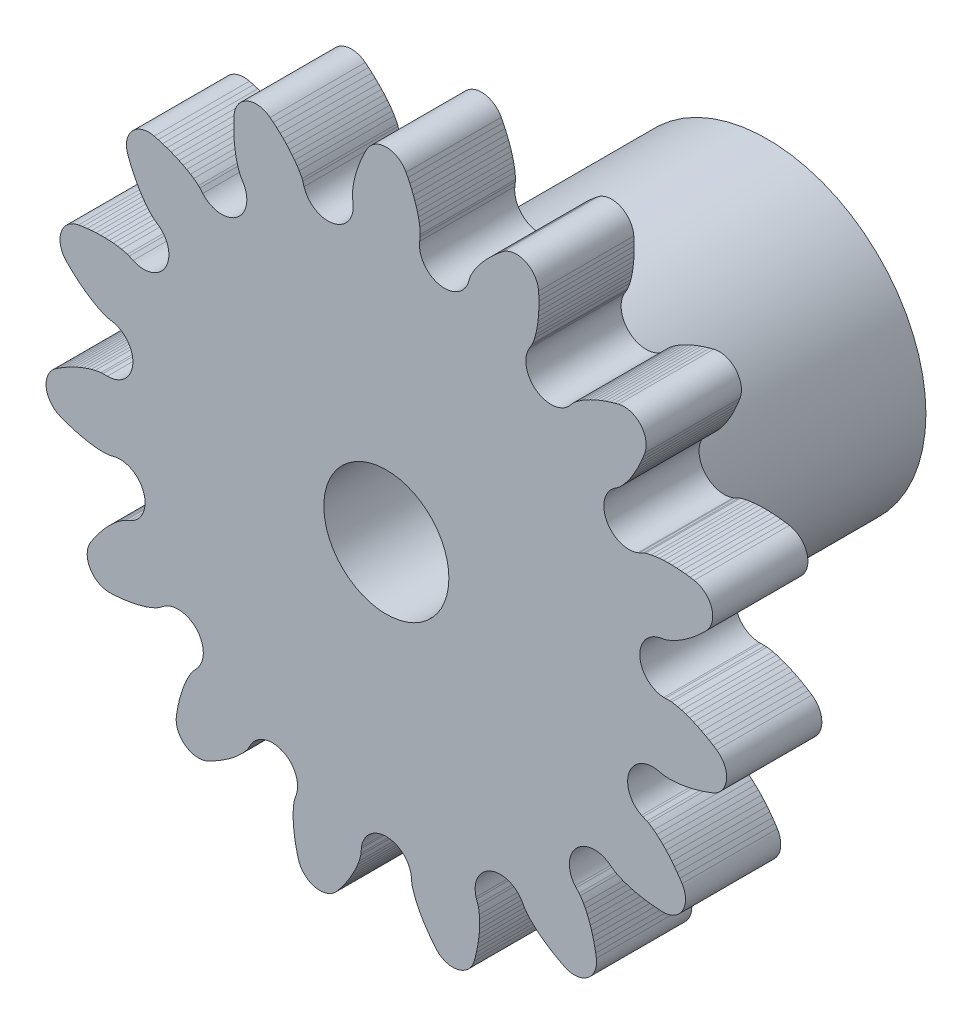
from build123d import *

# Parameters (mm, degrees)
SKETCH4_R                = 4.080437254
BOSS_EXTRUDE2_DEPTH      = 3.81
BOSS_EXTRUDE1_DEPTH      = 3.81
FILLET1_R                = 0.889
CIRPATTERN2_COUNT        = 15
FILLET1_OF_CIRPATTERN2_R = 0.889
SKETCH5_R                = 2.5019
CUT_EXTRUDE1_DEPTH       = 20.677497001
SKETCH6_R                = 6.35
SKETCH6_R_2              = 2.5019
BOSS_EXTRUDE3_DEPTH      = 11.43


with BuildPart() as part:
    # Sketch4 → Boss-Extrude2 (new body)
    with BuildSketch(Plane.XY):
        with Locations(Location((0, 0, 0), (0, 0, 180))):
            Circle(SKETCH4_R)
    extrude(amount=BOSS_EXTRUDE2_DEPTH)

    # Sketch1 → Boss-Extrude1 (add)
    with BuildSketch(Plane.XY):
        with BuildLine():
            Line((-5.727203022, 9.584886924), (0, 0))
            Line((0, 0), (-1.331341607, 11.085443594))
            ThreePointArc((-1.331341607, 11.085443594), (-2.121533089, 9.980789568), (-3.292644325, 10.668656973))
            Line((-3.292644325, 10.668656973), (-3.343436381, 10.833288433))
            ThreePointArc((-3.343436381, 10.833288433), (-3.356877559, 10.871989389), (-3.372994223, 10.90965479))
            ThreePointArc((-3.372994223, 10.90965479), (-3.426969585, 11.017509963), (-3.486197631, 11.122572404))
            ThreePointArc((-3.486197631, 11.122572404), (-3.527088708, 11.189062866), (-3.569743288, 11.254436015))
            ThreePointArc((-3.569743288, 11.254436015), (-3.619661426, 11.326868177), (-3.671293781, 11.39808853))
            ThreePointArc((-3.671293781, 11.39808853), (-3.721042914, 11.46360295), (-3.772124163, 11.528084123))
            ThreePointArc((-3.772124163, 11.528084123), (-3.828277473, 11.596152917), (-3.885722346, 11.663135315))
            ThreePointArc((-3.885722346, 11.663135315), (-3.942421682, 11.726852413), (-4.000224237, 11.789570416))
            ThreePointArc((-4.000224237, 11.789570416), (-4.062121628, 11.854478303), (-4.125087986, 11.918349724))
            ThreePointArc((-4.125087986, 11.918349724), (-4.187840191, 11.979987794), (-4.251545236, 12.040640562))
            ThreePointArc((-4.251545236, 12.040640562), (-4.318769191, 12.10271293), (-4.386915584, 12.163771168))
            ThreePointArc((-4.386915584, 12.163771168), (-4.455172703, 12.223150276), (-4.524271809, 12.281547418))
            ThreePointArc((-4.524271809, 12.281547418), (-5.163911996, 12.753446274), (-5.854570084, 13.146917371))
            ThreePointArc((-5.854570084, 13.146917371), (-6.024310443, 12.370332227), (-6.10161086, 11.57918112))
            ThreePointArc((-6.10161086, 11.57918112), (-6.104447354, 11.488798683), (-6.105991714, 11.398384938))
            ThreePointArc((-6.105991714, 11.398384938), (-6.106215438, 11.306886502), (-6.105068531, 11.215394979))
            ThreePointArc((-6.105068531, 11.215394979), (-6.102621739, 11.127468423), (-6.098806544, 11.039590597))
            ThreePointArc((-6.098806544, 11.039590597), (-6.093473553, 10.950059277), (-6.086658292, 10.86062855))
            ThreePointArc((-6.086658292, 10.86062855), (-6.078727197, 10.775706421), (-6.069319042, 10.690935186))
            ThreePointArc((-6.069319042, 10.690935186), (-6.057979544, 10.603425367), (-6.04496922, 10.516148307))
            ThreePointArc((-6.04496922, 10.516148307), (-6.031230397, 10.435041216), (-6.015830255, 10.354233125))
            ThreePointArc((-6.015830255, 10.354233125), (-5.997452019, 10.26820714), (-5.977019377, 10.182645922))
            ThreePointArc((-5.977019377, 10.182645922), (-5.956979208, 10.107204454), (-5.934934267, 10.032324174))
            ThreePointArc((-5.934934267, 10.032324174), (-5.896489009, 9.91800882), (-5.852455324, 9.805727549))
            ThreePointArc((-5.852455324, 9.805727549), (-5.835248675, 9.768547557), (-5.815483509, 9.73266214))
            Line((-5.815483509, 9.73266214), (-5.727203022, 9.584886924))
        make_face()
    boss_extrude1 = extrude(amount=BOSS_EXTRUDE1_DEPTH)

    # Fillet1
    fillet1_edges = [part.edges().sort_by_distance(p)[0] for p in [
        (-5.854570084, 13.146917371, 1.905),
    ]]
    fillet(fillet1_edges, radius=FILLET1_R)

    # CirPattern2: Boss-Extrude1 ×15 about axis
    cirpattern2_axis = Axis((0, 0, 0), (0, 0, 1))
    for i in range(1, CIRPATTERN2_COUNT):
        add(boss_extrude1.rotate(cirpattern2_axis, i * 360 / CIRPATTERN2_COUNT))

    # Fillet1 of CirPattern2
    fillet1_of_cirpattern2_edges = [part.edges().sort_by_distance(p)[0] for p in [
        (-10.695748945, 9.629038464, 1.905),
        (-13.687535646, 4.446211329, 1.905),
        (-14.312623086, -1.505406137, 1.905),
        (-12.462927968, -7.196725206, 1.905),
        (-8.458279383, -11.643665107, 1.905),
        (-2.991117451, -14.077309531, 1.905),
        (2.993235861, -14.076859249, 1.905),
        (8.460031501, -11.642392119, 1.905),
        (12.464010837, -7.194849623, 1.905),
        (14.312849467, -1.503252265, 1.905),
        (13.686866396, 4.448271067, 1.905),
        (10.694299784, 9.63064792, 1.905),
        (5.852591585, 13.147798256, 1.905),
        (-0.001082868, 14.391574829, 1.905),
    ]]
    fillet(fillet1_of_cirpattern2_edges, radius=FILLET1_OF_CIRPATTERN2_R)

    # Sketch5 → Cut-Extrude1 (cut, through all)
    with BuildSketch(Plane.XY.offset(3.81)):
        Circle(SKETCH5_R)
    extrude(amount=-CUT_EXTRUDE1_DEPTH, mode=Mode.SUBTRACT)

    # Sketch6 → Boss-Extrude3 (add)
    with BuildSketch(Plane.XY):
        Circle(SKETCH6_R)
        Circle(SKETCH6_R_2, mode=Mode.SUBTRACT)
    extrude(amount=-BOSS_EXTRUDE3_DEPTH)


solid = part.part
